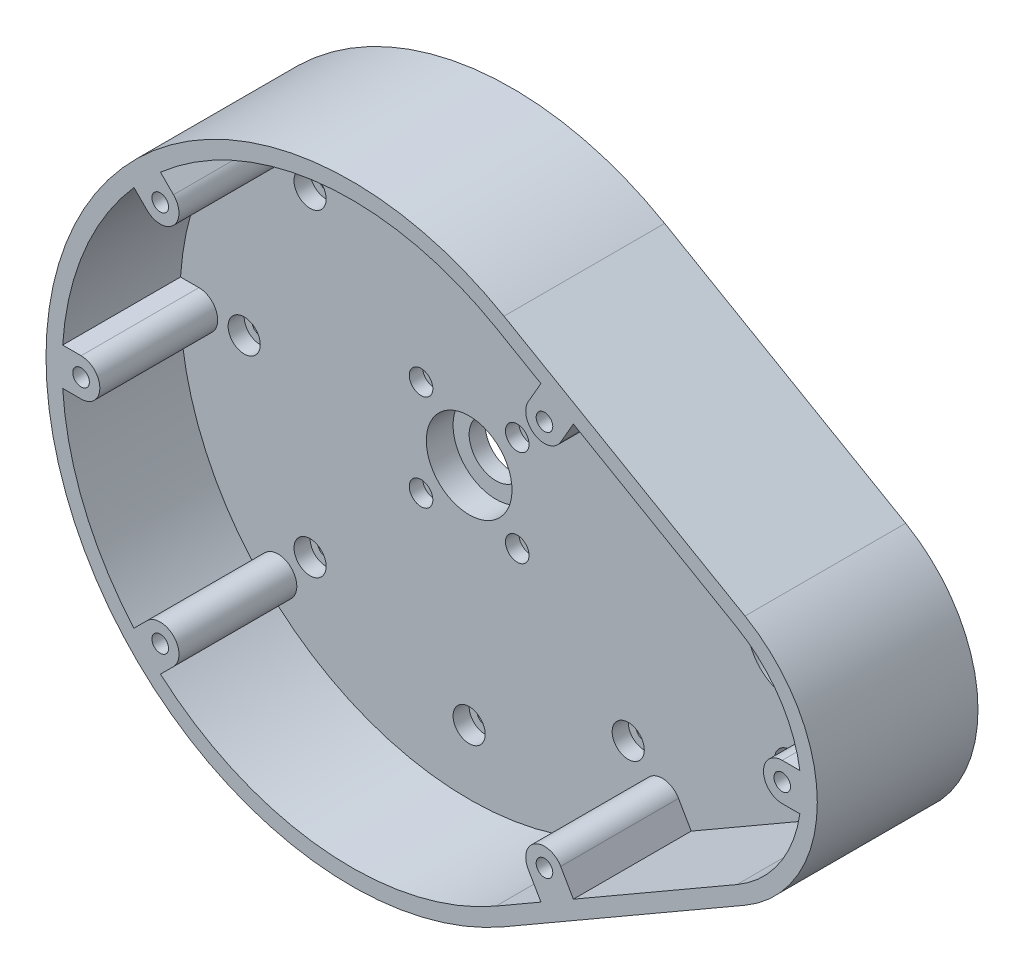
from build123d import *
from build123d.topology import SkipClean

# Parameters (mm, degrees)
BOSS_EXTRUDE1_DEPTH = 30
SKETCH3_R           = 1.55
CUT_EXTRUDE1_DEPTH  = 22
CUT_EXTRUDE2_START  = -30
SKETCH5_R           = 1.55
CUT_EXTRUDE2_DEPTH  = 30
SKETCH6_R           = 3
CUT_EXTRUDE3_DEPTH  = 5
SKETCH7_R           = 8
CUT_EXTRUDE10_DEPTH = 5
SKETCH8_R           = 5
SKETCH8_R_2         = 1.05
CUT_EXTRUDE7_DEPTH  = 8
SKETCH9_R           = 2.2
CUT_EXTRUDE8_DEPTH  = 2.5
SKETCH11_R          = 1.55
CUT_EXTRUDE11_DEPTH = 8
SKETCH12_R          = 3
CUT_EXTRUDE12_DEPTH = 3


with BuildPart() as part:
    # Sketch1 → Boss-Extrude1 (new body)
    with BuildSketch(Plane.XY):
        with BuildLine():
            Line((-1.5, 49.363448016), (43.5, 23.382685902))
            ThreePointArc((43.5, 23.382685902), (57, 0), (43.5, -23.382685902))
            Line((43.5, -23.382685902), (-1.5, -49.363448016))
            ThreePointArc((-1.5, -49.363448016), (-87, 0), (-1.5, 49.363448016))
        make_face()
    extrude(amount=BOSS_EXTRUDE1_DEPTH)

    # Sketch3 → Cut-Extrude1 (cut)
    with BuildSketch(Plane.XY.offset(30)):
        with Locations((50.449984706, 0.025940866)):
            Circle(SKETCH3_R)
        with Locations((-80.45, 0)):
            Circle(SKETCH3_R)
        with Locations((-65.673537111, 35.673537111)):
            Circle(SKETCH3_R)
        with Locations((-65.673537111, -35.673537111)):
            Circle(SKETCH3_R)
        with Locations((6.062445841, 36.062445841)):
            Circle(SKETCH3_R)
        with Locations((6.062445841, -36.062445841)):
            Circle(SKETCH3_R)
        with BuildLine():
            Line((-3, -46.765371804), (5.400248357, -41.915486154))
            Line((5.400248357, -41.915486154), (3.031356927, -37.812445841))
            ThreePointArc((3.031356927, -37.812445841), (4.312445841, -33.031356927), (9.093534754, -34.312445841))
            Line((9.093534754, -34.312445841), (11.462426183, -38.415486154))
            Line((11.462426183, -38.415486154), (42, -20.784609691))
            ThreePointArc((42, -20.784609691), (49.859000377, -13.476650327), (53.747229589, -3.474059134))
            Line((53.747229589, -3.474059134), (50.449984706, -3.474059134))
            ThreePointArc((50.449984706, -3.474059134), (46.949984706, 0.025940866), (50.449984706, 3.525940866))
            Line((50.449984706, 3.525940866), (53.739581736, 3.525940866))
            ThreePointArc((53.739581736, 3.525940866), (49.844264614, 13.498339229), (42, 20.784609691))
            Line((42, 20.784609691), (11.462426183, 38.415486154))
            Line((11.462426183, 38.415486154), (9.093534754, 34.312445841))
            ThreePointArc((9.093534754, 34.312445841), (4.312445841, 33.031356927), (3.031356927, 37.812445841))
            Line((3.031356927, 37.812445841), (5.400248357, 41.915486154))
            Line((5.400248357, 41.915486154), (-3, 46.765371804))
            ThreePointArc((-3, 46.765371804), (-35.308766962, 53.738412643), (-65.628603797, 40.578351266))
            Line((-65.628603797, 40.578351266), (-63.198663377, 38.148410845))
            ThreePointArc((-63.198663377, 38.148410845), (-63.198663377, 33.198663377), (-68.148410845, 33.198663377))
            Line((-68.148410845, 33.198663377), (-70.578351266, 35.628603797))
            ThreePointArc((-70.578351266, 35.628603797), (-79.889494756, 20.664905348), (-83.886454699, 3.5))
            Line((-83.886454699, 3.5), (-80.45, 3.5))
            ThreePointArc((-80.45, 3.5), (-76.95, 0), (-80.45, -3.5))
            Line((-80.45, -3.5), (-83.886454699, -3.5))
            ThreePointArc((-83.886454699, -3.5), (-79.889494756, -20.664905348), (-70.578351266, -35.628603797))
            Line((-70.578351266, -35.628603797), (-68.148410845, -33.198663377))
            ThreePointArc((-68.148410845, -33.198663377), (-63.198663377, -33.198663377), (-63.198663377, -38.148410845))
            Line((-63.198663377, -38.148410845), (-65.628603797, -40.578351266))
            ThreePointArc((-65.628603797, -40.578351266), (-35.308766962, -53.738412643), (-3, -46.765371804))
        make_face()
    extrude(amount=-CUT_EXTRUDE1_DEPTH, mode=Mode.SUBTRACT)

    # Sketch5 → Cut-Extrude2 (cut)
    with SkipClean():  # the faces are left unmerged after this step: merging them gives an invalid solid
        with BuildSketch(Plane(origin=(0, 0, 0), x_dir=(-1, 0, 0), z_dir=(0, 0, -1)).offset(CUT_EXTRUDE2_START)):
            with Locations((80.45, 0)):
                Circle(SKETCH5_R)
            with Locations((-50.449984706, 0.025940866)):
                Circle(SKETCH5_R)
            with Locations((-6.062445841, -36.062445841)):
                Circle(SKETCH5_R)
            with Locations((-6.062445841, 36.062445841)):
                Circle(SKETCH5_R)
            with Locations((65.673537111, 35.673537111)):
                Circle(SKETCH5_R)
            with Locations((65.673537111, -35.673537111)):
                Circle(SKETCH5_R)
        extrude(amount=CUT_EXTRUDE2_DEPTH, mode=Mode.SUBTRACT)

    # Sketch6 → Cut-Extrude3 (cut)
    with SkipClean():  # the faces are left unmerged after this step: merging them gives an invalid solid
        with BuildSketch(Plane(origin=(0, 0, 0), x_dir=(-1, 0, 0), z_dir=(0, 0, -1))):
            with Locations((-50.449984706, 0.025940866)):
                Circle(SKETCH6_R)
            with Locations((80.45, 0)):
                Circle(SKETCH6_R)
            with Locations((65.673537111, 35.673537111)):
                Circle(SKETCH6_R)
            with Locations((-6.062445841, 36.062445841)):
                Circle(SKETCH6_R)
            with Locations((65.673537111, -35.673537111)):
                Circle(SKETCH6_R)
            with Locations((-6.062445841, -36.062445841)):
                Circle(SKETCH6_R)
        extrude(amount=-CUT_EXTRUDE3_DEPTH, mode=Mode.SUBTRACT)

    # Sketch7 → Cut-Extrude10 (cut)
    with SkipClean():  # the faces are left unmerged after this step: merging them gives an invalid solid
        with BuildSketch(Plane.XY.offset(8)):
            with Locations((-30, 0)):
                Circle(SKETCH7_R)
            with Locations((30, 0)):
                Circle(SKETCH7_R)
        extrude(amount=-CUT_EXTRUDE10_DEPTH, mode=Mode.SUBTRACT)

    # Sketch8 → Cut-Extrude7 (cut)
    with SkipClean():  # the faces are left unmerged after this step: merging them gives an invalid solid
        with BuildSketch(Plane.XY.offset(8)):
            with Locations((-30, 0)):
                Circle(SKETCH8_R)
            with Locations((-38.980256121, 8.980256121)):
                Circle(SKETCH8_R_2)
            with Locations((-21.019743879, 8.980256121)):
                Circle(SKETCH8_R_2)
            with Locations((-21.019743879, -8.980256121)):
                Circle(SKETCH8_R_2)
            with Locations((-38.980256121, -8.980256121)):
                Circle(SKETCH8_R_2)
        extrude(amount=-CUT_EXTRUDE7_DEPTH, mode=Mode.SUBTRACT)

    # Sketch9 → Cut-Extrude8 (cut)
    with SkipClean():  # the faces are left unmerged after this step: merging them gives an invalid solid
        with BuildSketch(Plane.XY.offset(8)):
            with Locations((-38.980256121, 8.980256121)):
                Circle(SKETCH9_R)
            with Locations((-21.019743879, 8.980256121)):
                Circle(SKETCH9_R)
            with Locations((-21.019743879, -8.980256121)):
                Circle(SKETCH9_R)
            with Locations((-38.980256121, -8.980256121)):
                Circle(SKETCH9_R)
        extrude(amount=-CUT_EXTRUDE8_DEPTH, mode=Mode.SUBTRACT)

    # Sketch11 → Cut-Extrude11 (cut)
    with SkipClean():  # the faces are left unmerged after this step: merging them gives an invalid solid
        with BuildSketch(Plane.XY.offset(8)):
            with Locations((-0.30151519, 29.69848481)):
                Circle(SKETCH11_R)
            with Locations((-30, 42)):
                Circle(SKETCH11_R)
            with Locations((-59.69848481, 29.69848481)):
                Circle(SKETCH11_R)
            with Locations((-72, 0)):
                Circle(SKETCH11_R)
            with Locations((-59.69848481, -29.69848481)):
                Circle(SKETCH11_R)
            with Locations((-30, -42)):
                Circle(SKETCH11_R)
            with Locations((-0.30151519, -29.69848481)):
                Circle(SKETCH11_R)
            with Locations((30, 19)):
                Circle(SKETCH11_R)
            with Locations((30, -19)):
                Circle(SKETCH11_R)
            with Locations((42, 0)):
                Circle(SKETCH11_R)
        extrude(amount=-CUT_EXTRUDE11_DEPTH, mode=Mode.SUBTRACT)

    # Sketch12 → Cut-Extrude12 (cut)
    with SkipClean():  # the faces are left unmerged after this step: merging them gives an invalid solid
        with BuildSketch(Plane.XY.offset(8)):
            with Locations((-0.30151519, 29.69848481)):
                Circle(SKETCH12_R)
            with Locations((-30, 42)):
                Circle(SKETCH12_R)
            with Locations((-59.69848481, 29.69848481)):
                Circle(SKETCH12_R)
            with Locations((-72, 0)):
                Circle(SKETCH12_R)
            with Locations((-59.69848481, -29.69848481)):
                Circle(SKETCH12_R)
            with Locations((-30, -42)):
                Circle(SKETCH12_R)
            with Locations((-0.30151519, -29.69848481)):
                Circle(SKETCH12_R)
            with Locations((30, 19)):
                Circle(SKETCH12_R)
            with Locations((42, 0)):
                Circle(SKETCH12_R)
            with Locations((30, -19)):
                Circle(SKETCH12_R)
        extrude(amount=-CUT_EXTRUDE12_DEPTH, mode=Mode.SUBTRACT)


solid = part.part
